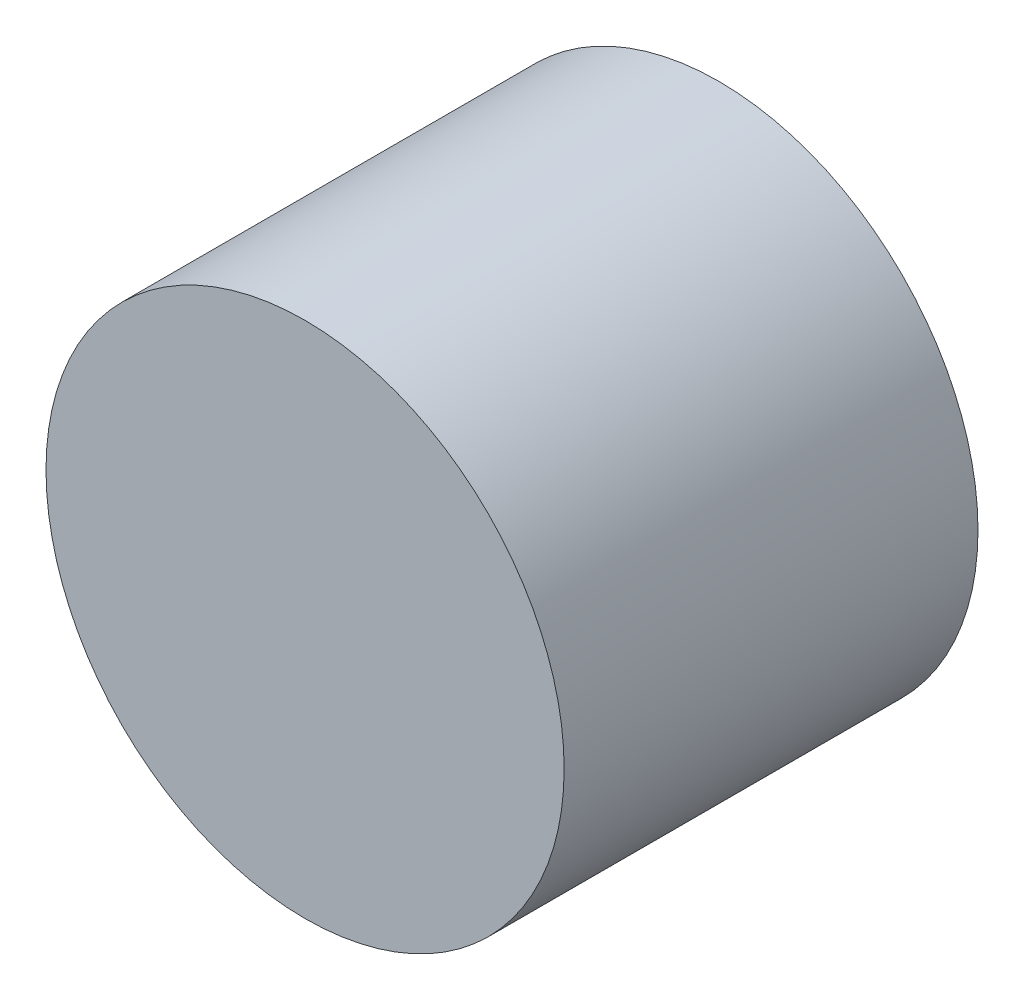
from build123d import *

# Parameters (mm, degrees)
SKETCH1_R           = 15.9
BOSS_EXTRUDE1_DEPTH = 25.4


with BuildPart() as part:
    # Sketch1 → Boss-Extrude1 (new body)
    with BuildSketch(Plane.XY):
        Circle(SKETCH1_R)
    extrude(amount=BOSS_EXTRUDE1_DEPTH)


solid = part.part
